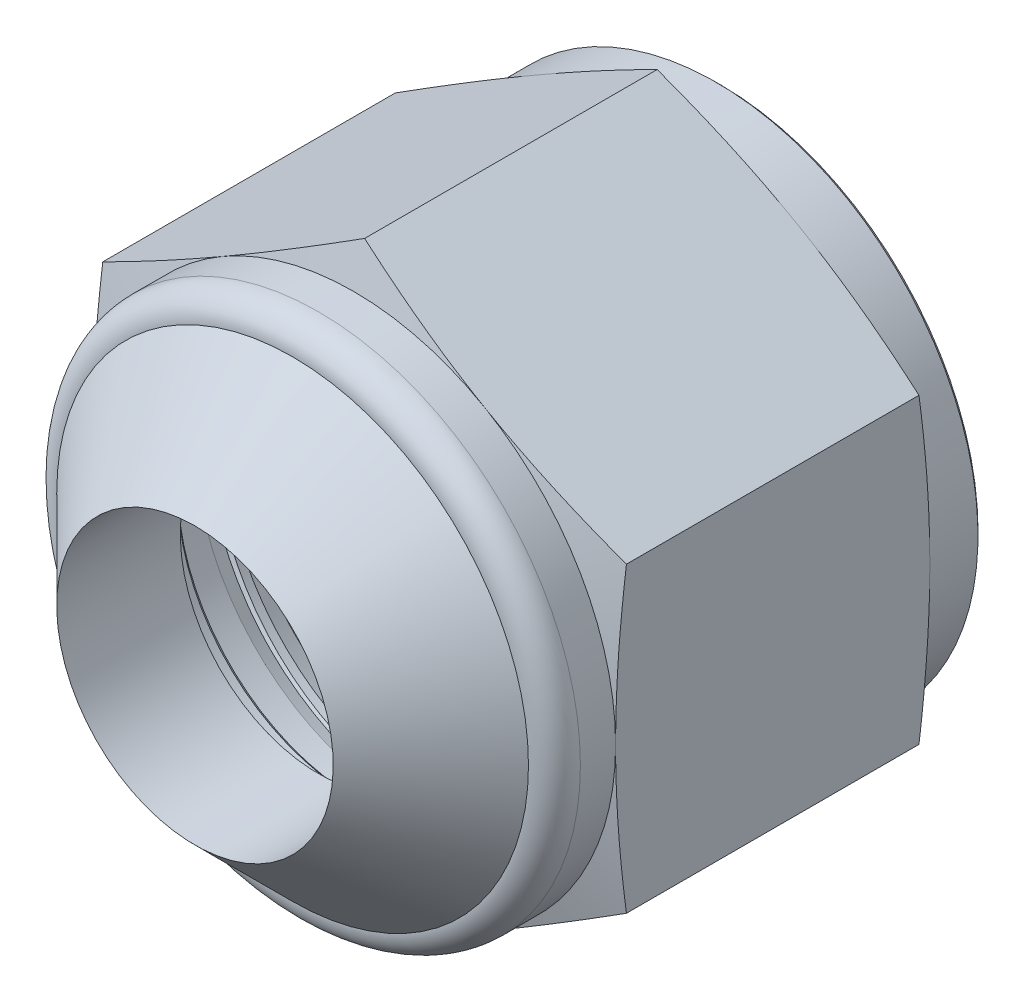
from build123d import *
from build123d.topology import SkipClean

# Parameters (mm, degrees)
BOSS_EXTRUDE1_DEPTH = 25.9334
FILLET1_R           = 1.5748
CHAMFER1_SIZE       = 0.254
CHAMFER2_SIZE       = 0.254
CUT_SWEEP1_PITCH    = 2.116666667


with BuildPart() as part:
    # Sketch1 → Boss-Extrude1 (new body)
    with BuildSketch(Plane.XY):
        Polygon((0, 18.330871047), (-15.875, 9.165435523), (-15.875, -9.165435523), (0, -18.330871047), (15.875, -9.165435523), (15.875, 9.165435523), align=None)
    extrude(amount=BOSS_EXTRUDE1_DEPTH)

    # Sketch2 → Cut-Revolve1 (revolve, cut)
    with BuildSketch(Plane(origin=(0, 0, 0), x_dir=(0, 0, -1), z_dir=(1, 0, 0))):
        Polygon((-25.9334, 20.786742094), (-25.9334, 15.875), (-22.225, 15.875), (-21.566951336, 18.330871047), (-3.833048664, 18.330871047), (-3.175, 15.875), (0, 15.875), (0, 20.786742094), align=None)
        with BuildLine():
            Line((-25.9334, 10.5918), (-25.9334, 0))
            Line((-25.9334, 0), (0, 0))
            Line((0, 0), (0, 12.720416378))
            Line((0, 12.720416378), (-21.7932, 12.720416378))
            ThreePointArc((-21.7932, 12.720416378), (-21.972805122, 12.6460215), (-22.0472, 12.466416378))
            Line((-22.0472, 12.466416378), (-22.0472, 10.5918))
            Line((-22.0472, 10.5918), (-25.9334, 10.5918))
        make_face()
    revolve(axis=Axis((0, 0, 0), (0, 0, 1)), mode=Mode.SUBTRACT)

    # Fillet1
    fillet1_edges = [part.edges().sort_by_distance(p)[0] for p in [
        (0, -15.875, 25.9334),
    ]]
    fillet(fillet1_edges, radius=FILLET1_R)

    # Chamfer1
    chamfer1_edges = [part.edges().sort_by_distance(p)[0] for p in [
        (0, -15.875, 0),
    ]]
    chamfer(chamfer1_edges, length=CHAMFER1_SIZE)

    # Chamfer2
    chamfer2_edges = [part.edges().sort_by_distance(p)[0] for p in [
        (0, -10.5918, 25.9334),
        (0, -10.5918, 22.0472),
    ]]
    chamfer(chamfer2_edges, length=CHAMFER2_SIZE)

    # Cut-Sweep1: the profile of Sketch4 screwed along a right-hand helix of 10.036 turns, 10 arcs to a turn; built about Z, then put on its axis
    cut_sweep1_z = Axis((0, 0, 0), (0, 0, 1))
    cut_sweep1_corners = [(13.952021776, 0, -0.711067708), (12.505601483, 0, 0.124023437), (12.505601483, 0, -1.744596354), (13.952021776, 0, -0.909505208), (14.009305748, 0, -0.810286458)]
    with BuildLine(mode=Mode.PRIVATE) as cut_sweep1_profile:
        Line(cut_sweep1_corners[0], cut_sweep1_corners[1])
        Line(cut_sweep1_corners[1], cut_sweep1_corners[2])
        Line(cut_sweep1_corners[2], cut_sweep1_corners[3])
        ThreePointArc((13.952021776, 0, -0.909505208), (13.993956554, 0, -0.86757043), (14.009305748, 0, -0.810286458))
        ThreePointArc((14.009305748, 0, -0.810286458), (13.993956554, 0, -0.753002486), (13.952021776, 0, -0.711067708))
    cut_sweep1_cap = Face(cut_sweep1_profile.wire())
    cut_sweep1_arcs = [((13.952021776, 0, -0.909505208), (14.009305748, 0, -0.876432292), (14.009305748, 0, -0.810286458), (1, 0.8660254037844366, 1)), ((14.009305748, 0, -0.810286458), (14.009305748, 0, -0.744140625), (13.952021776, 0, -0.711067708), (1, 0.8660254037844366, 1))]  # start, shoulder, end, weights
    cut_sweep1_turn_angles = [0, 18, 36, 54, 72, 90, 108, 126, 144, 162, 180, 198, 216, 234, 252, 270, 288, 306, 324, 342, 360]
    cut_sweep1_turn_weights = [1, 0.9510565162951535, 1, 0.9510565162951535, 1, 0.9510565162951535, 1, 0.9510565162951535, 1, 0.9510565162951535, 1, 0.9510565162951535, 1, 0.9510565162951535, 1, 0.9510565162951535, 1, 0.9510565162951535, 1, 0.9510565162951535, 1]
    cut_sweep1_turn_rails = [Edge.make_bspline([Vector(p[0], p[1], 0).rotate(cut_sweep1_z, cut_sweep1_turn_angles[k]) / cut_sweep1_turn_weights[k] + Vector(0, 0, p[2] + CUT_SWEEP1_PITCH * cut_sweep1_turn_angles[k] / 360) for k in range(21)], [0, 0, 0, 1, 1, 2, 2, 3, 3, 4, 4, 5, 5, 6, 6, 7, 7, 8, 8, 9, 9, 10, 10, 10], 2, cut_sweep1_turn_weights) for p in cut_sweep1_corners]
    cut_sweep1_turn_sides = [*[Face.make_surface_from_curves(cut_sweep1_turn_rails[p[0]], cut_sweep1_turn_rails[p[1]]) for p in [(0, 1), (1, 2), (2, 3)]], *[Face.make_bezier_surface([[Vector(p[j][0], p[j][1], 0).rotate(cut_sweep1_z, cut_sweep1_turn_angles[2 * i + k]) / cut_sweep1_turn_weights[2 * i + k] + Vector(0, 0, p[j][2] + CUT_SWEEP1_PITCH * cut_sweep1_turn_angles[2 * i + k] / 360) for k in range(3)] for j in range(3)], [[p[3][j] * cut_sweep1_turn_weights[2 * i + k] for k in range(3)] for j in range(3)]) for p in cut_sweep1_arcs for i in range(10)]]
    cut_sweep1_last_angles = [3600, 3606.48, 3612.96]
    cut_sweep1_last_weights = [1, 0.9936113105199756, 1]
    cut_sweep1_last_rails = [Edge.make_bspline([Vector(p[0], p[1], 0).rotate(cut_sweep1_z, cut_sweep1_last_angles[k]) / cut_sweep1_last_weights[k] + Vector(0, 0, p[2] + CUT_SWEEP1_PITCH * cut_sweep1_last_angles[k] / 360) for k in range(3)], [0, 0, 0, 1, 1, 1], 2, cut_sweep1_last_weights) for p in cut_sweep1_corners]
    cut_sweep1_last_sides = [*[Face.make_surface_from_curves(cut_sweep1_last_rails[p[0]], cut_sweep1_last_rails[p[1]]) for p in [(0, 1), (1, 2), (2, 3)]], *[Face.make_bezier_surface([[Vector(p[j][0], p[j][1], 0).rotate(cut_sweep1_z, cut_sweep1_last_angles[2 * i + k]) / cut_sweep1_last_weights[2 * i + k] + Vector(0, 0, p[j][2] + CUT_SWEEP1_PITCH * cut_sweep1_last_angles[2 * i + k] / 360) for k in range(3)] for j in range(3)], [[p[3][j] * cut_sweep1_last_weights[2 * i + k] for k in range(3)] for j in range(3)]) for p in cut_sweep1_arcs for i in range(1)]]
    cut_sweep1 = Plane(origin=(0, 0, 0), x_dir=(0, 1, 0), z_dir=(0, 0, 1)) * Solid(Shell([*[p.moved(Location((0, 0, CUT_SWEEP1_PITCH * i))) for i in range(10) for p in cut_sweep1_turn_sides], *cut_sweep1_last_sides, cut_sweep1_cap, cut_sweep1_cap.rotate(cut_sweep1_z, 3612.96).moved(Location((0, 0, CUT_SWEEP1_PITCH * 3612.96 / 360)))]))
    add(cut_sweep1, mode=Mode.SUBTRACT)

    # Cut-Extrude1 cone 1 section (through the dimple's axis) → Cut-Extrude1 (revolve, cut)
    with BuildSketch(Plane.YZ):
        Polygon((0, 0), (13.4874, 0), (0, 13.4874), align=None)
    revolve(axis=Axis((0, 0, 0), (0, 0, 1)), mode=Mode.SUBTRACT)

    # Sketch6 → Revolve1 (revolve)
    with SkipClean():  # the faces are left unmerged after this step: merging them gives an invalid solid
        with BuildSketch(Plane(origin=(0, 0, 0), x_dir=(0, 0, -1), z_dir=(1, 0, 0))):
            Polygon((-22.0472, 14.123873692), (-13.6398, 14.123873692), (-19.1262, 12.720416378), (-22.0472, 12.720416378), align=None)
        revolve(axis=Axis((0, 0, 0), (0, 0, 1)))

    # Sketch9 → Revolve2 (revolve)
    with SkipClean():  # the faces are left unmerged after this step: merging them gives an invalid solid
        with BuildSketch(Plane(origin=(0, 0, 0), x_dir=(0, 0, -1), z_dir=(1, 0, 0))):
            Polygon((-24.3586, 15.875), (-24.3586, 8.382), (-31.8516, 8.382), align=None)
        revolve(axis=Axis((0, 0, 24.3586), (0, 0, 1)))


solid = part.part
